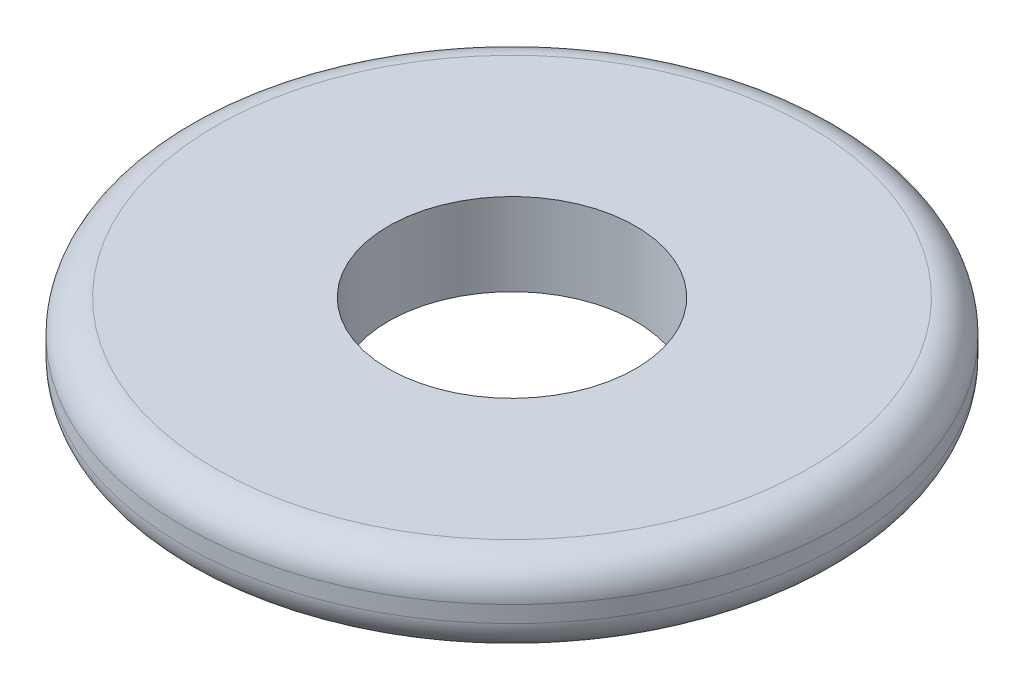
from build123d import *

# Parameters (mm, degrees)
SKETCH1_R           = 25.4
SKETCH1_R_2         = 9.525
BOSS_EXTRUDE1_DEPTH = 6.35
FILLET1_R           = 2.54


with BuildPart() as part:
    # Sketch1 → Boss-Extrude1 (new body)
    with BuildSketch(Plane(origin=(0, 0, 0), x_dir=(1, 0, 0), z_dir=(0, 1, 0))):
        Circle(SKETCH1_R)
        Circle(SKETCH1_R_2, mode=Mode.SUBTRACT)
    extrude(amount=BOSS_EXTRUDE1_DEPTH)

    # Fillet1
    fillet1_edges = [part.edges().sort_by_distance(p)[0] for p in [
        (-25.4, 0, 0),
        (-25.4, 6.35, 0),
    ]]
    fillet(fillet1_edges, radius=FILLET1_R)


solid = part.part
